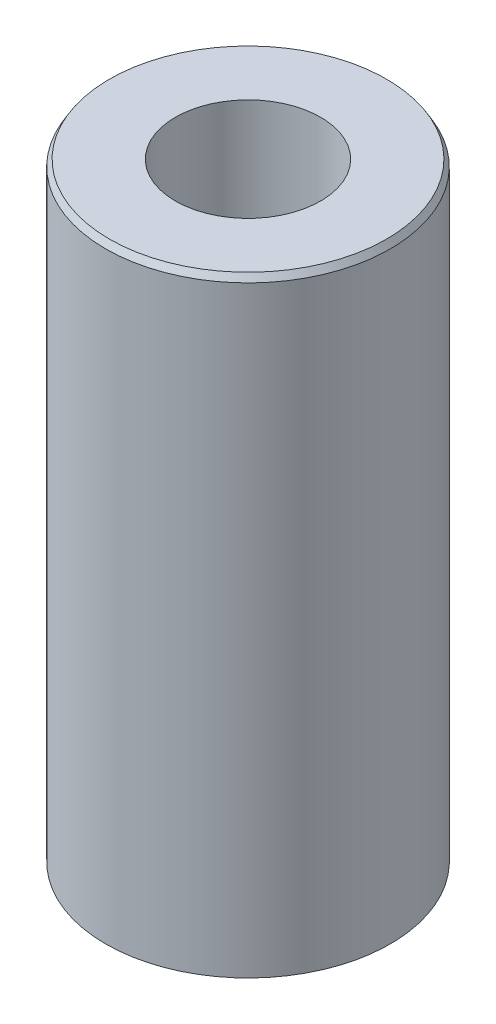
from build123d import *
from OCP.BRepFilletAPI import BRepFilletAPI_MakeChamfer

# Parameters (mm, degrees)
SKETCH1_R           = 52.5
BOSS_EXTRUDE1_DEPTH = 225.832721328
SKETCH2_R           = 26.783268674
CUT_EXTRUDE1_DEPTH  = 238.724458192
CHAMFER1_SIZE       = 2.419011449
CHAMFER1_SIZE2      = 1.396616911


with BuildPart() as part:
    # Sketch1 → Boss-Extrude1 (new body)
    with BuildSketch(Plane(origin=(0, 0, 0), x_dir=(1, 0, 0), z_dir=(0, 1, 0))):
        Circle(SKETCH1_R)
    extrude(amount=BOSS_EXTRUDE1_DEPTH)

    # Sketch2 → Cut-Extrude1 (cut, through all)
    with BuildSketch(Plane(origin=(0, 0, 0), x_dir=(1, 0, 0), z_dir=(0, 1, 0))):
        Circle(SKETCH2_R)
    extrude(amount=CUT_EXTRUDE1_DEPTH, mode=Mode.SUBTRACT)

    # Chamfer1: one chamfer whose edges measure the first distance from different faces: ONE call of the kernel's chamfer builder (chamfer() names one face for all edges)
    chamfer1_edges_1 = [part.edges().sort_by_distance(p)[0] for p in [
        (-52.5, 225.832721328, 0),
    ]]
    chamfer1_side_1 = [part.faces().sort_by_distance(p)[0] for p in [
        (-52.5, 112.916360664, 0),
    ]]
    chamfer1_edges_2 = [part.edges().sort_by_distance(p)[0] for p in [
        (-52.5, 0, 0),
    ]]
    chamfer1_side_2 = [part.faces().sort_by_distance(p)[0] for p in [
        (-51.01507576, 0, 0),
    ]]
    chamfer1 = BRepFilletAPI_MakeChamfer(part.part.solid().wrapped)
    for e in chamfer1_edges_1:
        chamfer1.Add(CHAMFER1_SIZE, CHAMFER1_SIZE2, e.wrapped, chamfer1_side_1[0].wrapped)  # the first distance lies on this face
    for e in chamfer1_edges_2:
        chamfer1.Add(CHAMFER1_SIZE, CHAMFER1_SIZE2, e.wrapped, chamfer1_side_2[0].wrapped)  # the first distance lies on this face
    add(Compound.cast(chamfer1.Shape()), mode=Mode.REPLACE)


solid = part.part
